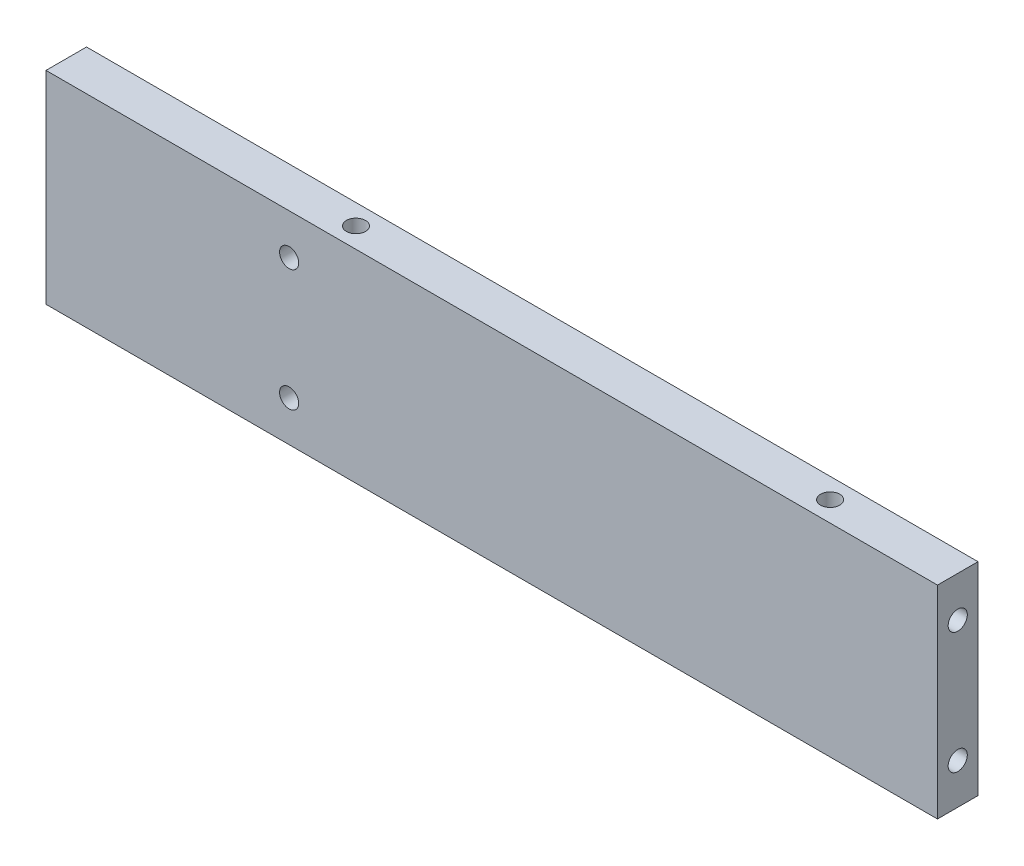
from build123d import *

# Parameters (mm, degrees)
TOP_PROFILE_W                  = 139.7
TOP_PROFILE_H                  = 6.35
WALL_MID_DEPTH                 = 31.75
F_3_0MM_DOWEL_HOLE1_D          = 3
MOTOR_INTERFERECNE_DEPTH       = 3.81
FILLET2_R                      = 5.08
F_3_0MM_DOWEL_HOLE2_AT_2_COUNT = 2
F_3_0MM_DOWEL_HOLE2_AT_2_PITCH = 19.05
F_3_0MM_DOWEL_HOLE4_D          = 3
F_3_0MM_DOWEL_HOLE4_DEPTH      = 6.35
F_3_0MM_DOWEL_HOLE4_TIP        = 0.901290929


with BuildPart() as part:
    # top profile → wall mid (new body)
    with BuildSketch(Plane(origin=(0, 0, 0), x_dir=(1, 0, 0), z_dir=(0, 1, 0))):
        with Locations((69.85, -3.175)):
            Rectangle(TOP_PROFILE_W, TOP_PROFILE_H)
    extrude(amount=WALL_MID_DEPTH)

    # Ø3.0mm Dowel Hole1 (through all)
    with Locations(Plane(origin=(0, 0, 0), x_dir=(1, 0, 0), z_dir=(0, 0, -1))):
        with Locations((38.1, -6.35), (38.1, -25.4)):
            Hole(F_3_0MM_DOWEL_HOLE1_D / 2)

    # Sketch8 → motor interferecne (cut)
    with BuildSketch(Plane.XY):
        Polygon((10.16, 28.575), (35.56, 28.575), (35.56, 20.955), (38.1, 20.955), (38.1, 10.795), (35.56, 10.795), (35.56, 3.175), (10.16, 3.175), align=None)
    extrude(amount=MOTOR_INTERFERECNE_DEPTH, mode=Mode.SUBTRACT)

    # Fillet2
    # the kernel refuses this fillet: 5.08 mm, written as the material it adds along each edge
    with BuildSketch(Plane(origin=(10.16, 3.175, 0), x_dir=(1, 0, 0), z_dir=(0, 0, 1)), Plane(origin=(35.56, 3.175, 0), x_dir=(0, 1, 0), z_dir=(0, 0, 1)), Plane(origin=(35.56, 28.575, 0), x_dir=(-1, 0, 0), z_dir=(0, 0, 1))) as fillet2_piece_1:
        with BuildLine():
            CenterArc((FILLET2_R, FILLET2_R), FILLET2_R, 180, 90)
            Line((0, FILLET2_R), (-FILLET2_R * 0.02, FILLET2_R))
            Line((-FILLET2_R * 0.02, FILLET2_R), (-FILLET2_R * 0.02, -FILLET2_R * 0.02))
            Line((-FILLET2_R * 0.02, -FILLET2_R * 0.02), (FILLET2_R, -FILLET2_R * 0.02))
            Line((FILLET2_R, -FILLET2_R * 0.02), (FILLET2_R, 0))
        make_face()
    extrude(amount=3.81)
    with BuildSketch(Plane(origin=(10.16, 28.575, 0), x_dir=(1, 0, 0), z_dir=(0, 0, 1))) as fillet2_piece_2:
        with BuildLine():
            CenterArc((FILLET2_R, -FILLET2_R), FILLET2_R, 90, 90)
            Line((0, -FILLET2_R), (-FILLET2_R * 0.02, -FILLET2_R))
            Line((-FILLET2_R * 0.02, -FILLET2_R), (-FILLET2_R * 0.02, FILLET2_R * 0.02))
            Line((-FILLET2_R * 0.02, FILLET2_R * 0.02), (FILLET2_R, FILLET2_R * 0.02))
            Line((FILLET2_R, FILLET2_R * 0.02), (FILLET2_R, 0))
        make_face()
    extrude(amount=3.81)
    with BuildSketch(Plane(origin=(38.1, 10.795, 0), x_dir=(0, 1, 0), z_dir=(0, 0, 1))) as fillet2_piece_3:
        with BuildLine():
            CenterArc((4.399409051, 5.08), FILLET2_R, 210, 60)
            Line((0, 2.54), (-0.087988181, 2.4892))
            ThreePointArc((-0.087988181, 2.4892), (-0.1016, 1.27), (-0.1016, 0))
            Line((-0.1016, 0), (0, -0.1016))
            Line((0, -0.1016), (4.399409051, -0.1016))
            Line((4.399409051, -0.1016), (4.399409051, 0))
        make_face()
    extrude(amount=3.81)
    with BuildSketch(Plane(origin=(38.1, 20.955, 0), x_dir=(-1, 0, 0), z_dir=(0, 0, 1))) as fillet2_piece_4:
        with BuildLine():
            CenterArc((5.08, 4.399409051), FILLET2_R, 180, 60)
            Line((0, 4.399409051), (-0.1016, 4.399409051))
            Line((-0.1016, 4.399409051), (-0.1016, 0))
            Line((-0.1016, 0), (0, -0.1016))
            ThreePointArc((0, -0.1016), (1.27, -0.1016), (2.4892, -0.087988181))
            Line((2.4892, -0.087988181), (2.54, 0))
        make_face()
    extrude(amount=3.81)

    # Sketch13 → Ø3.0mm Dowel Hole2 (revolve, cut)
    with BuildSketch(Plane(origin=(0, 25.4, 3.175), x_dir=(0, 0, 1), z_dir=(0, 1, 0))):
        Polygon((0, 0), (0, 8.521290929), (1.5, 7.62), (1.5, 0), align=None)
    f_3_0mm_dowel_hole2 = revolve(axis=Axis((-6.35, 25.4, 3.175), (1, 0, 0)), mode=Mode.SUBTRACT)

    # Ø3.0mm Dowel Hole2 at 2: Ø3.0mm Dowel Hole2 ×2
    with Locations(*[(0, -i * F_3_0MM_DOWEL_HOLE2_AT_2_PITCH, 0) for i in range(1, F_3_0MM_DOWEL_HOLE2_AT_2_COUNT)]):
        add(f_3_0mm_dowel_hole2, mode=Mode.SUBTRACT)

    # Mirror1: Ø3.0mm Dowel Hole2 across plane
    add(f_3_0mm_dowel_hole2.mirror(Plane.ZY.offset(-69.85)), mode=Mode.SUBTRACT)

    # Mirror1 copy 1 sketch → Mirror1 copy 1 (revolve, cut)
    with BuildSketch(Plane(origin=(139.7, 6.35, 3.175), x_dir=(0, 0, 1), z_dir=(0, 1, 0))):
        Polygon((0, 0), (0, -8.521290929), (1.5, -7.62), (1.5, 0), align=None)
    revolve(axis=Axis((146.05, 6.35, 3.175), (1, 0, 0)), mode=Mode.SUBTRACT)

    # Ø3.0mm Dowel Hole4
    with Locations(Plane(origin=(146.05, 31.75, -25.4), x_dir=(-1, 0, 0), z_dir=(0, 1, 0))):
        with Locations((26.35, 28.575), (100.65, 28.575)):
            Hole(F_3_0MM_DOWEL_HOLE4_D / 2, depth=F_3_0MM_DOWEL_HOLE4_DEPTH)
            with Locations((0, 0, -(F_3_0MM_DOWEL_HOLE4_DEPTH + F_3_0MM_DOWEL_HOLE4_TIP / 2))):  # 118° drill point
                Cone(0, F_3_0MM_DOWEL_HOLE4_D / 2, F_3_0MM_DOWEL_HOLE4_TIP, mode=Mode.SUBTRACT)


solid = part.part
